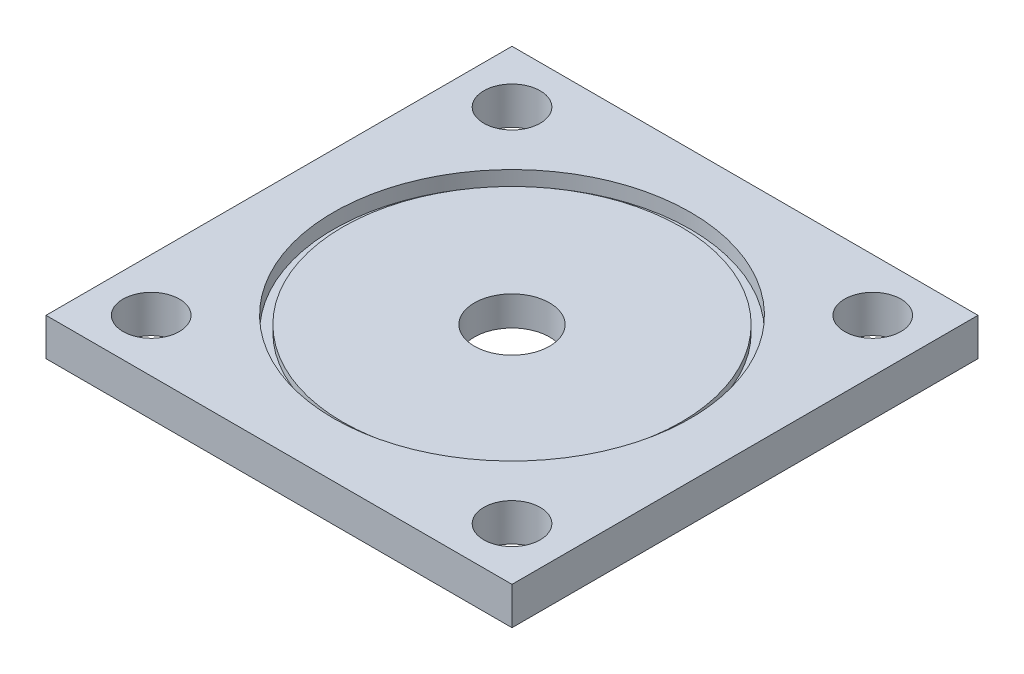
from build123d import *

# Parameters (mm, degrees)
PLATEOUTLINE_W      = 78.74
PLATEOUTLINE_H      = 78.74
BOSS_EXTRUDE1_DEPTH = 6.35
RAILGUIDES_R        = 4.7625
CUT_EXTRUDE1_DEPTH  = 10
CUT_EXTRUDE2_START  = 5
FUELGRAINMOUNTING_R = 30.1625
CUT_EXTRUDE2_DEPTH  = 5
GASINTAKE_R         = 6.35
CUT_EXTRUDE3_DEPTH  = 5
CUT_EXTRUDE4_START  = 3.857
SKETCH1_R           = 30.1625
SKETCH1_R_2         = 28.575
CUT_EXTRUDE4_DEPTH  = 1.143


with BuildPart() as part:
    # plateOutline → Boss-Extrude1 (new body)
    with BuildSketch(Plane(origin=(0, 0, 0), x_dir=(1, 0, 0), z_dir=(0, 1, 0))):
        Rectangle(PLATEOUTLINE_W, PLATEOUTLINE_H)
    extrude(amount=BOSS_EXTRUDE1_DEPTH)

    # railGuides → Cut-Extrude1 (cut)
    with BuildSketch(Plane(origin=(0, 0, 0), x_dir=(1, 0, 0), z_dir=(0, 1, 0))):
        with Locations((-30.48, 30.48)):
            Circle(RAILGUIDES_R)
        with Locations((30.48, 30.48)):
            Circle(RAILGUIDES_R)
        with Locations((30.48, -30.48)):
            Circle(RAILGUIDES_R)
        with Locations((-30.48, -30.48)):
            Circle(RAILGUIDES_R)
    extrude(amount=CUT_EXTRUDE1_DEPTH, mode=Mode.SUBTRACT)

    # FuelGrainMounting → Cut-Extrude2 (cut)
    with BuildSketch(Plane(origin=(0, 0, 0), x_dir=(1, 0, 0), z_dir=(0, 1, 0)).offset(CUT_EXTRUDE2_START)):
        Circle(FUELGRAINMOUNTING_R)
    extrude(amount=CUT_EXTRUDE2_DEPTH, mode=Mode.SUBTRACT)

    # GasIntake → Cut-Extrude3 (cut)
    with BuildSketch(Plane(origin=(0, 0, 0), x_dir=(1, 0, 0), z_dir=(0, 1, 0))):
        Circle(GASINTAKE_R)
    extrude(amount=CUT_EXTRUDE3_DEPTH, mode=Mode.SUBTRACT)

    # Sketch1 → Cut-Extrude4 (cut)
    with BuildSketch(Plane(origin=(0, 0, 0), x_dir=(1, 0, 0), z_dir=(0, 1, 0)).offset(CUT_EXTRUDE4_START)):
        Circle(SKETCH1_R)
        Circle(SKETCH1_R_2, mode=Mode.SUBTRACT)
    extrude(amount=CUT_EXTRUDE4_DEPTH, mode=Mode.SUBTRACT)


solid = part.part
